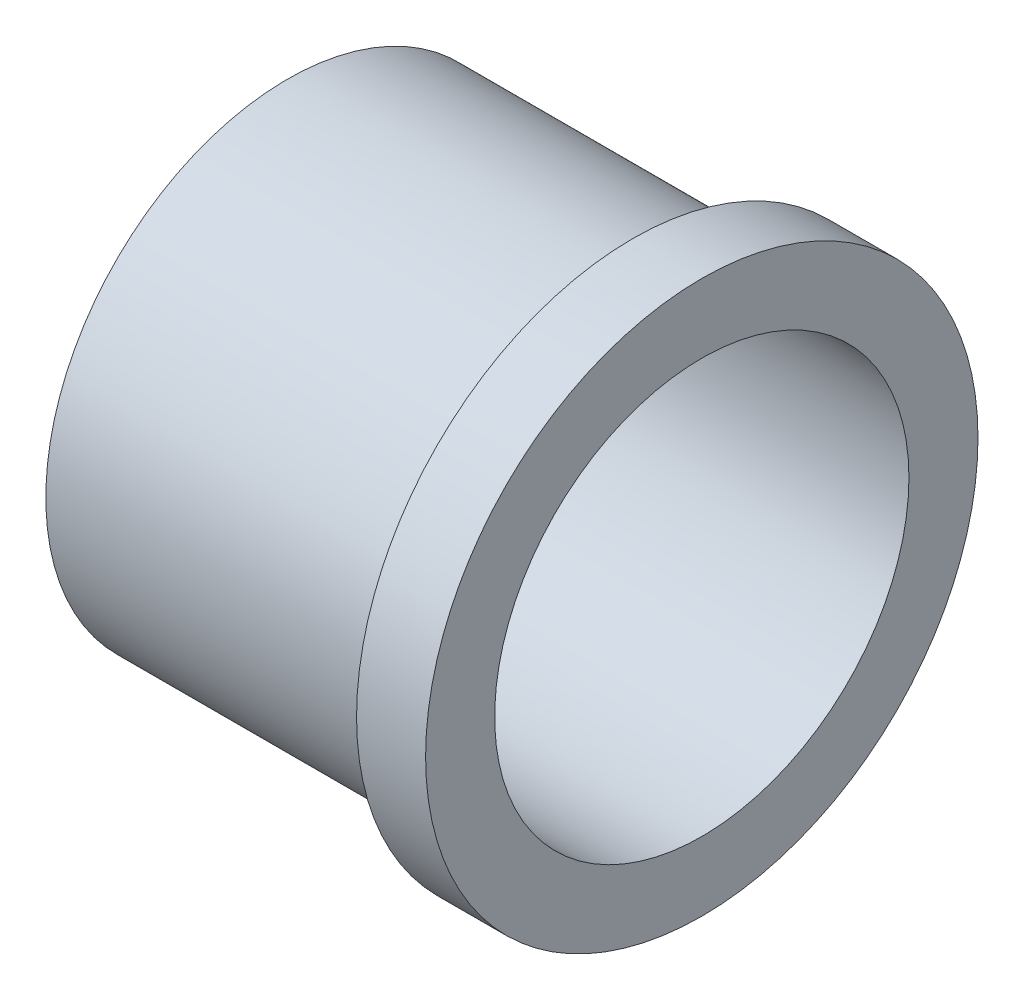
from build123d import *


with BuildPart() as part:
    # Croquis1 → Revolución1 (revolve)
    with BuildSketch(Plane(origin=(0, 0, 0), x_dir=(-1, 0, 0), z_dir=(0, 1, 0))):
        Polygon((0, 4), (0, 3), (6, 3), (6, 3.5), (1, 3.5), (1, 4), align=None)
    revolve(axis=Axis((0, 0, 0), (-1, 0, 0)))


solid = part.part
